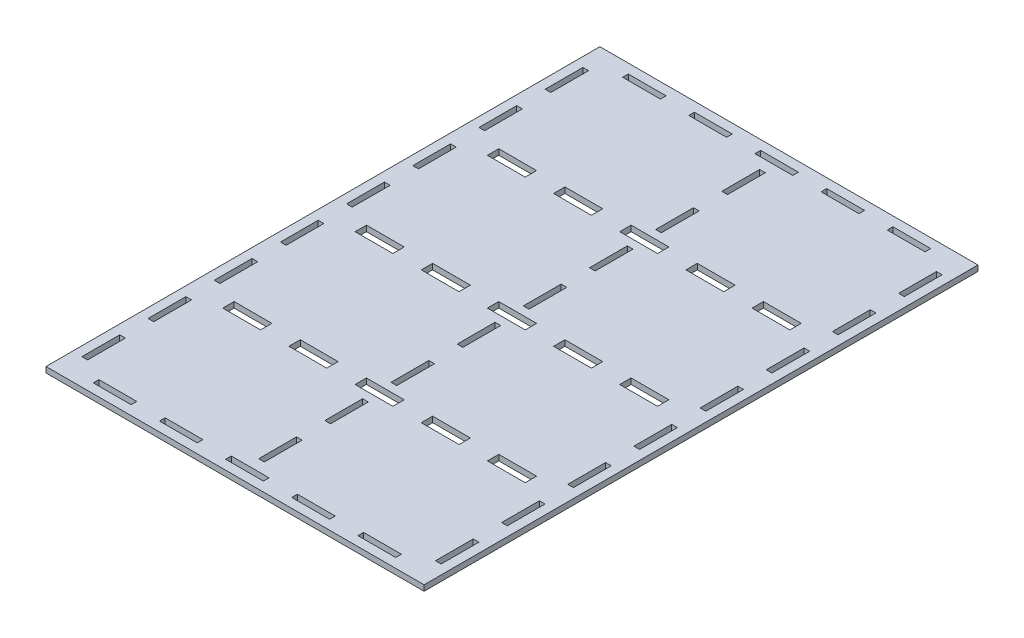
from build123d import *

# Parameters (mm, degrees)
SKETCH1_W             = 200
SKETCH1_H             = 293
SKETCH1_W_2           = 20
SKETCH1_H_2           = 3
SKETCH1_W_3           = 3
SKETCH1_H_3           = 20
BOSS_EXTRUDE1_DEPTH   = 3
SKETCH2_W             = 20
SKETCH2_H             = 3
SKETCH2_W_2           = 3
SKETCH2_H_2           = 20
CUT_EXTRUDE2_DEPTH    = 10
LPATTERN3_START       = 55
LPATTERN3_OUTLINE_W   = 3
LPATTERN3_OUTLINE_H   = 3
LPATTERN3_DEPTH       = 20
LPATTERN3_START_2     = 90
LPATTERN3_2_OUTLINE_W = 3
LPATTERN3_2_OUTLINE_H = 3
LPATTERN3_2_DEPTH     = 20
LPATTERN3_START_3     = 125
LPATTERN3_3_OUTLINE_W = 3
LPATTERN3_3_OUTLINE_H = 3
LPATTERN3_3_DEPTH     = 20
LPATTERN3_START_4     = 160
LPATTERN3_4_OUTLINE_W = 3
LPATTERN3_4_OUTLINE_H = 3
LPATTERN3_4_DEPTH     = 20
LPATTERN3_START_5     = 20
LPATTERN3_5_OUTLINE_W = 3
LPATTERN3_5_OUTLINE_H = 3
LPATTERN3_5_DEPTH     = 20
LPATTERN4_START       = -244
LPATTERN4_OUTLINE_W   = 3
LPATTERN4_OUTLINE_H   = 3
LPATTERN4_DEPTH       = 20
LPATTERN4_START_2     = -209
LPATTERN4_2_OUTLINE_W = 3
LPATTERN4_2_OUTLINE_H = 3
LPATTERN4_2_DEPTH     = 20
LPATTERN4_START_3     = -174
LPATTERN4_3_OUTLINE_W = 3
LPATTERN4_3_OUTLINE_H = 3
LPATTERN4_3_DEPTH     = 20
LPATTERN4_START_4     = -139
LPATTERN4_4_OUTLINE_W = 3
LPATTERN4_4_OUTLINE_H = 3
LPATTERN4_4_DEPTH     = 20
LPATTERN4_START_5     = -104
LPATTERN4_5_OUTLINE_W = 3
LPATTERN4_5_OUTLINE_H = 3
LPATTERN4_5_DEPTH     = 20
LPATTERN4_START_6     = -69
LPATTERN4_6_OUTLINE_W = 3
LPATTERN4_6_OUTLINE_H = 3
LPATTERN4_6_DEPTH     = 20
LPATTERN4_START_7     = -34
LPATTERN4_7_OUTLINE_W = 3
LPATTERN4_7_OUTLINE_H = 3
LPATTERN4_7_DEPTH     = 20
LPATTERN4_START_8     = -279
LPATTERN4_8_OUTLINE_W = 3
LPATTERN4_8_OUTLINE_H = 3
LPATTERN4_8_DEPTH     = 20
SKETCH4_W             = 20
SKETCH4_H             = 6
CUT_EXTRUDE3_DEPTH    = 10
LPATTERN5_COUNT       = 5
LPATTERN5_PITCH       = 35
LPATTERN5_COUNT_DIR2  = 3
LPATTERN5_PITCH_DIR2  = 70


# Read off the part's stored shape, not the designer's step: LPattern3, LPattern4
with BuildPart() as part:
    # Sketch1 → Boss-Extrude1 (new body)
    # profile 1 of 3: a face of its own
    with BuildSketch(Plane(origin=(0, 0, 0), x_dir=(1, 0, 0), z_dir=(0, 1, 0))):
        with Locations((100, 146.5)):
            Rectangle(SKETCH1_W, SKETCH1_H)
        with Locations((30, 286.5)):
            Rectangle(SKETCH1_W_2, SKETCH1_H_2, mode=Mode.SUBTRACT)
        with Locations((6.5, 269)):
            Rectangle(SKETCH1_W_3, SKETCH1_H_3, mode=Mode.SUBTRACT)
    # profile 2 of 3: a face of its own
    with BuildSketch(Plane(origin=(0, 0, 0), x_dir=(1, 0, 0), z_dir=(0, 1, 0))):
        with Locations((30, 286.5)):
            Rectangle(SKETCH1_W_2, SKETCH1_H_2)
    # profile 3 of 3: a face of its own
    with BuildSketch(Plane(origin=(0, 0, 0), x_dir=(1, 0, 0), z_dir=(0, 1, 0))):
        with Locations((6.5, 269)):
            Rectangle(SKETCH1_W_3, SKETCH1_H_3)
    extrude(amount=BOSS_EXTRUDE1_DEPTH)

    # Sketch2 → Cut-Extrude2 (cut)
    with BuildSketch(Plane(origin=(0, 3, 0), x_dir=(1, 0, 0), z_dir=(0, 1, 0))):
        with Locations((30, 286.5)):
            Rectangle(SKETCH2_W, SKETCH2_H)
        with Locations((6.5, 269)):
            Rectangle(SKETCH2_W_2, SKETCH2_H_2)
    extrude(amount=-CUT_EXTRUDE2_DEPTH, mode=Mode.SUBTRACT)

    # LPattern3 outline → LPattern3 (cut)
    with BuildSketch(Plane.YZ.offset(LPATTERN3_START)):
        with Locations((1.5, -6.5)):
            Rectangle(LPATTERN3_OUTLINE_W, LPATTERN3_OUTLINE_H)
        with Locations((1.5, -76.5)):
            Rectangle(LPATTERN3_OUTLINE_W, LPATTERN3_OUTLINE_H)
        with Locations((1.5, -146.5)):
            Rectangle(LPATTERN3_OUTLINE_W, LPATTERN3_OUTLINE_H)
        with Locations((1.5, -216.5)):
            Rectangle(LPATTERN3_OUTLINE_W, LPATTERN3_OUTLINE_H)
        with Locations((1.5, -286.5)):
            Rectangle(LPATTERN3_OUTLINE_W, LPATTERN3_OUTLINE_H)
    extrude(amount=LPATTERN3_DEPTH, mode=Mode.SUBTRACT)

    # LPattern3 2 outline → LPattern3 2 (cut)
    with BuildSketch(Plane.YZ.offset(LPATTERN3_START_2)):
        with Locations((1.5, -6.5)):
            Rectangle(LPATTERN3_2_OUTLINE_W, LPATTERN3_2_OUTLINE_H)
        with Locations((1.5, -76.5)):
            Rectangle(LPATTERN3_2_OUTLINE_W, LPATTERN3_2_OUTLINE_H)
        with Locations((1.5, -146.5)):
            Rectangle(LPATTERN3_2_OUTLINE_W, LPATTERN3_2_OUTLINE_H)
        with Locations((1.5, -216.5)):
            Rectangle(LPATTERN3_2_OUTLINE_W, LPATTERN3_2_OUTLINE_H)
        with Locations((1.5, -286.5)):
            Rectangle(LPATTERN3_2_OUTLINE_W, LPATTERN3_2_OUTLINE_H)
    extrude(amount=LPATTERN3_2_DEPTH, mode=Mode.SUBTRACT)

    # LPattern3 3 outline → LPattern3 3 (cut)
    with BuildSketch(Plane.YZ.offset(LPATTERN3_START_3)):
        with Locations((1.5, -6.5)):
            Rectangle(LPATTERN3_3_OUTLINE_W, LPATTERN3_3_OUTLINE_H)
        with Locations((1.5, -76.5)):
            Rectangle(LPATTERN3_3_OUTLINE_W, LPATTERN3_3_OUTLINE_H)
        with Locations((1.5, -146.5)):
            Rectangle(LPATTERN3_3_OUTLINE_W, LPATTERN3_3_OUTLINE_H)
        with Locations((1.5, -216.5)):
            Rectangle(LPATTERN3_3_OUTLINE_W, LPATTERN3_3_OUTLINE_H)
        with Locations((1.5, -286.5)):
            Rectangle(LPATTERN3_3_OUTLINE_W, LPATTERN3_3_OUTLINE_H)
    extrude(amount=LPATTERN3_3_DEPTH, mode=Mode.SUBTRACT)

    # LPattern3 4 outline → LPattern3 4 (cut)
    with BuildSketch(Plane.YZ.offset(LPATTERN3_START_4)):
        with Locations((1.5, -6.5)):
            Rectangle(LPATTERN3_4_OUTLINE_W, LPATTERN3_4_OUTLINE_H)
        with Locations((1.5, -76.5)):
            Rectangle(LPATTERN3_4_OUTLINE_W, LPATTERN3_4_OUTLINE_H)
        with Locations((1.5, -146.5)):
            Rectangle(LPATTERN3_4_OUTLINE_W, LPATTERN3_4_OUTLINE_H)
        with Locations((1.5, -216.5)):
            Rectangle(LPATTERN3_4_OUTLINE_W, LPATTERN3_4_OUTLINE_H)
        with Locations((1.5, -286.5)):
            Rectangle(LPATTERN3_4_OUTLINE_W, LPATTERN3_4_OUTLINE_H)
    extrude(amount=LPATTERN3_4_DEPTH, mode=Mode.SUBTRACT)

    # LPattern3 5 outline → LPattern3 5 (cut)
    with BuildSketch(Plane.YZ.offset(LPATTERN3_START_5)):
        with Locations((1.5, -6.5)):
            Rectangle(LPATTERN3_5_OUTLINE_W, LPATTERN3_5_OUTLINE_H)
        with Locations((1.5, -76.5)):
            Rectangle(LPATTERN3_5_OUTLINE_W, LPATTERN3_5_OUTLINE_H)
        with Locations((1.5, -146.5)):
            Rectangle(LPATTERN3_5_OUTLINE_W, LPATTERN3_5_OUTLINE_H)
        with Locations((1.5, -216.5)):
            Rectangle(LPATTERN3_5_OUTLINE_W, LPATTERN3_5_OUTLINE_H)
    extrude(amount=LPATTERN3_5_DEPTH, mode=Mode.SUBTRACT)

    # LPattern4 outline → LPattern4 (cut)
    with BuildSketch(Plane.XY.offset(LPATTERN4_START)):
        with Locations((193.5, 1.5)):
            Rectangle(LPATTERN4_OUTLINE_W, LPATTERN4_OUTLINE_H)
        with Locations((100, 1.5)):
            Rectangle(LPATTERN4_OUTLINE_W, LPATTERN4_OUTLINE_H)
        with Locations((6.5, 1.5)):
            Rectangle(LPATTERN4_OUTLINE_W, LPATTERN4_OUTLINE_H)
    extrude(amount=LPATTERN4_DEPTH, mode=Mode.SUBTRACT)

    # LPattern4 2 outline → LPattern4 2 (cut)
    with BuildSketch(Plane.XY.offset(LPATTERN4_START_2)):
        with Locations((193.5, 1.5)):
            Rectangle(LPATTERN4_2_OUTLINE_W, LPATTERN4_2_OUTLINE_H)
        with Locations((100, 1.5)):
            Rectangle(LPATTERN4_2_OUTLINE_W, LPATTERN4_2_OUTLINE_H)
        with Locations((6.5, 1.5)):
            Rectangle(LPATTERN4_2_OUTLINE_W, LPATTERN4_2_OUTLINE_H)
    extrude(amount=LPATTERN4_2_DEPTH, mode=Mode.SUBTRACT)

    # LPattern4 3 outline → LPattern4 3 (cut)
    with BuildSketch(Plane.XY.offset(LPATTERN4_START_3)):
        with Locations((193.5, 1.5)):
            Rectangle(LPATTERN4_3_OUTLINE_W, LPATTERN4_3_OUTLINE_H)
        with Locations((100, 1.5)):
            Rectangle(LPATTERN4_3_OUTLINE_W, LPATTERN4_3_OUTLINE_H)
        with Locations((6.5, 1.5)):
            Rectangle(LPATTERN4_3_OUTLINE_W, LPATTERN4_3_OUTLINE_H)
    extrude(amount=LPATTERN4_3_DEPTH, mode=Mode.SUBTRACT)

    # LPattern4 4 outline → LPattern4 4 (cut)
    with BuildSketch(Plane.XY.offset(LPATTERN4_START_4)):
        with Locations((193.5, 1.5)):
            Rectangle(LPATTERN4_4_OUTLINE_W, LPATTERN4_4_OUTLINE_H)
        with Locations((100, 1.5)):
            Rectangle(LPATTERN4_4_OUTLINE_W, LPATTERN4_4_OUTLINE_H)
        with Locations((6.5, 1.5)):
            Rectangle(LPATTERN4_4_OUTLINE_W, LPATTERN4_4_OUTLINE_H)
    extrude(amount=LPATTERN4_4_DEPTH, mode=Mode.SUBTRACT)

    # LPattern4 5 outline → LPattern4 5 (cut)
    with BuildSketch(Plane.XY.offset(LPATTERN4_START_5)):
        with Locations((193.5, 1.5)):
            Rectangle(LPATTERN4_5_OUTLINE_W, LPATTERN4_5_OUTLINE_H)
        with Locations((100, 1.5)):
            Rectangle(LPATTERN4_5_OUTLINE_W, LPATTERN4_5_OUTLINE_H)
        with Locations((6.5, 1.5)):
            Rectangle(LPATTERN4_5_OUTLINE_W, LPATTERN4_5_OUTLINE_H)
    extrude(amount=LPATTERN4_5_DEPTH, mode=Mode.SUBTRACT)

    # LPattern4 6 outline → LPattern4 6 (cut)
    with BuildSketch(Plane.XY.offset(LPATTERN4_START_6)):
        with Locations((193.5, 1.5)):
            Rectangle(LPATTERN4_6_OUTLINE_W, LPATTERN4_6_OUTLINE_H)
        with Locations((100, 1.5)):
            Rectangle(LPATTERN4_6_OUTLINE_W, LPATTERN4_6_OUTLINE_H)
        with Locations((6.5, 1.5)):
            Rectangle(LPATTERN4_6_OUTLINE_W, LPATTERN4_6_OUTLINE_H)
    extrude(amount=LPATTERN4_6_DEPTH, mode=Mode.SUBTRACT)

    # LPattern4 7 outline → LPattern4 7 (cut)
    with BuildSketch(Plane.XY.offset(LPATTERN4_START_7)):
        with Locations((193.5, 1.5)):
            Rectangle(LPATTERN4_7_OUTLINE_W, LPATTERN4_7_OUTLINE_H)
        with Locations((100, 1.5)):
            Rectangle(LPATTERN4_7_OUTLINE_W, LPATTERN4_7_OUTLINE_H)
        with Locations((6.5, 1.5)):
            Rectangle(LPATTERN4_7_OUTLINE_W, LPATTERN4_7_OUTLINE_H)
    extrude(amount=LPATTERN4_7_DEPTH, mode=Mode.SUBTRACT)

    # LPattern4 8 outline → LPattern4 8 (cut)
    with BuildSketch(Plane.XY.offset(LPATTERN4_START_8)):
        with Locations((193.5, 1.5)):
            Rectangle(LPATTERN4_8_OUTLINE_W, LPATTERN4_8_OUTLINE_H)
        with Locations((100, 1.5)):
            Rectangle(LPATTERN4_8_OUTLINE_W, LPATTERN4_8_OUTLINE_H)
    extrude(amount=LPATTERN4_8_DEPTH, mode=Mode.SUBTRACT)

    # Sketch4 → Cut-Extrude3 (cut)
    with BuildSketch(Plane(origin=(0, 3, 0), x_dir=(1, 0, 0), z_dir=(0, 1, 0))):
        with Locations((30, 216.5)):
            Rectangle(SKETCH4_W, SKETCH4_H)
    cut_extrude3 = extrude(amount=-CUT_EXTRUDE3_DEPTH, mode=Mode.SUBTRACT)

    # LPattern5: Cut-Extrude3 5 × 3
    with Locations(*[(i * LPATTERN5_PITCH, 0, j * LPATTERN5_PITCH_DIR2) for i in range(LPATTERN5_COUNT) for j in range(LPATTERN5_COUNT_DIR2) if (i, j) != (0, 0)]):
        add(cut_extrude3, mode=Mode.SUBTRACT)


solid = part.part
